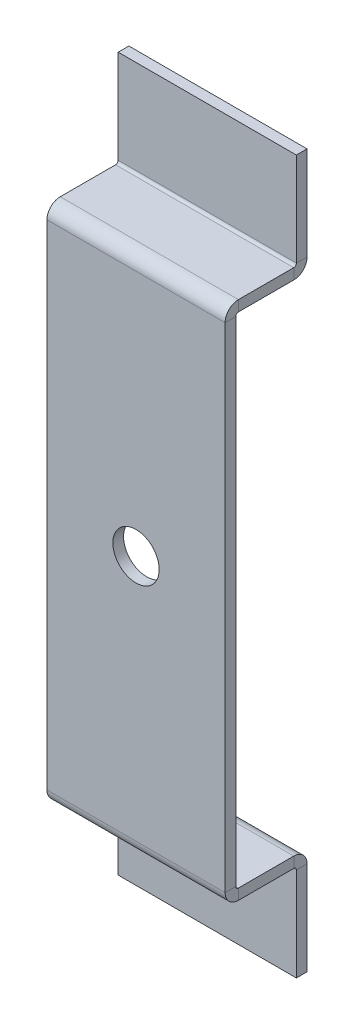
from build123d import *

# Parameters (mm, degrees)
SKETCH_1_W                         = 50
SKETCH_1_H                         = 140
SM_BASE_FLANGE_1_DEPTH             = 3
SM_EDGE_FLANGE_1_STRIP_W           = 13.4732
SM_EDGE_FLANGE_1_STRIP_H           = 3
SM_EDGE_FLANGE_1_STRIP_CUT_DEPTH   = 50
SM_EDGE_FLANGE_1_STRIP_2_W         = 13.4732
SM_EDGE_FLANGE_1_STRIP_2_H         = 3
SM_EDGE_FLANGE_1_STRIP_CUT_2_DEPTH = 50
SM_EDGE_FLANGE_1_DEPTH             = 50
SM_EDGE_FLANGE_1_BEND_DEPTH        = 50
SM_EDGE_FLANGE_2_STRIP_W           = 13.4732
SM_EDGE_FLANGE_2_STRIP_H           = 3
SM_EDGE_FLANGE_2_STRIP_CUT_DEPTH   = 50
SM_EDGE_FLANGE_2_STRIP_2_W         = 13.4732
SM_EDGE_FLANGE_2_STRIP_2_H         = 3
SM_EDGE_FLANGE_2_STRIP_CUT_2_DEPTH = 50
SM_EDGE_FLANGE_2_DEPTH             = 50
SM_EDGE_FLANGE_2_BEND_DEPTH        = 50
SKETCH_18_R                        = 6.5
CUT_EXTRUDE_1_DEPTH                = 179.686876966


# Sheet-metal steps are written as plain solids
with BuildPart() as part:
    # Sketch 1 → 基体-法兰1 (new body)
    with BuildSketch(Plane.XY):
        with Locations((25, 70)):
            Rectangle(SKETCH_1_W, SKETCH_1_H)
    extrude(amount=-SM_BASE_FLANGE_1_DEPTH)

    # 边线-法兰1 strip (across the edge) → 边线-法兰1 strip cut (cut)
    with BuildSketch(Plane(origin=(0, 140, -3), x_dir=(0, -1, 0), z_dir=(1, 0, 0))):
        with Locations((-6, -1.5)):
            Rectangle(SM_EDGE_FLANGE_1_STRIP_W, SM_EDGE_FLANGE_1_STRIP_H)
    extrude(amount=SM_EDGE_FLANGE_1_STRIP_CUT_DEPTH, mode=Mode.SUBTRACT)

    # 边线-法兰1 strip 2 (across the edge) → 边线-法兰1 strip cut 2 (cut)
    with BuildSketch(Plane(origin=(50, 0, -3), x_dir=(0, 1, 0), z_dir=(-1, 0, 0))):
        with Locations((-6, -1.5)):
            Rectangle(SM_EDGE_FLANGE_1_STRIP_2_W, SM_EDGE_FLANGE_1_STRIP_2_H)
    extrude(amount=SM_EDGE_FLANGE_1_STRIP_CUT_2_DEPTH, mode=Mode.SUBTRACT)

    # 边线-法兰1 section (across the edge) → 边线-法兰1 (add)
    with BuildSketch(Plane(origin=(0, 140, -3), x_dir=(0, -1, 0), z_dir=(1, 0, 0))):
        with BuildLine():
            Line((-3, 0.7366), (-3, 17))
            Line((-3, 17), (0, 17))
            Line((0, 17), (0, 0.7366))
            ThreePointArc((0, 0.7366), (0.215745145, 0.215745145), (0.7366, 0))
            Line((0.7366, 0), (0.7366, -3))
            ThreePointArc((0.7366, -3), (-1.905575199, -1.905575199), (-3, 0.7366))
        make_face()
    extrude(amount=SM_EDGE_FLANGE_1_DEPTH)

    # 边线-法兰1 section 2 (across the edge) → 边线-法兰1 bend (add)
    with BuildSketch(Plane(origin=(50, 0, -3), x_dir=(0, 1, 0), z_dir=(-1, 0, 0))):
        with BuildLine():
            Line((-3, 0.7366), (-3, 17))
            Line((-3, 17), (0, 17))
            Line((0, 17), (0, 0.7366))
            ThreePointArc((0, 0.7366), (0.215745145, 0.215745145), (0.7366, 0))
            Line((0.7366, 0), (0.7366, -3))
            ThreePointArc((0.7366, -3), (-1.905575199, -1.905575199), (-3, 0.7366))
        make_face()
    extrude(amount=SM_EDGE_FLANGE_1_BEND_DEPTH)

    # 边线-法兰2 strip (across the edge) → 边线-法兰2 strip cut (cut)
    with BuildSketch(Plane(origin=(0, -3, -20), x_dir=(0, 0, 1), z_dir=(1, 0, 0))):
        with Locations((-6, -1.5)):
            Rectangle(SM_EDGE_FLANGE_2_STRIP_W, SM_EDGE_FLANGE_2_STRIP_H)
    extrude(amount=SM_EDGE_FLANGE_2_STRIP_CUT_DEPTH, mode=Mode.SUBTRACT)

    # 边线-法兰2 strip 2 (across the edge) → 边线-法兰2 strip cut 2 (cut)
    with BuildSketch(Plane(origin=(50, 143, -20), x_dir=(0, 0, 1), z_dir=(-1, 0, 0))):
        with Locations((-6, -1.5)):
            Rectangle(SM_EDGE_FLANGE_2_STRIP_2_W, SM_EDGE_FLANGE_2_STRIP_2_H)
    extrude(amount=SM_EDGE_FLANGE_2_STRIP_CUT_2_DEPTH, mode=Mode.SUBTRACT)

    # 边线-法兰2 section (across the edge) → 边线-法兰2 (add)
    with BuildSketch(Plane(origin=(0, -3, -20), x_dir=(0, 0, 1), z_dir=(1, 0, 0))):
        with BuildLine():
            Line((-3, 0.7366), (-3, 27))
            Line((-3, 27), (0, 27))
            Line((0, 27), (0, 0.7366))
            ThreePointArc((0, 0.7366), (0.215745145, 0.215745145), (0.7366, 0))
            Line((0.7366, 0), (0.7366, -3))
            ThreePointArc((0.7366, -3), (-1.905575199, -1.905575199), (-3, 0.7366))
        make_face()
    extrude(amount=SM_EDGE_FLANGE_2_DEPTH)

    # 边线-法兰2 section 2 (across the edge) → 边线-法兰2 bend (add)
    with BuildSketch(Plane(origin=(50, 143, -20), x_dir=(0, 0, 1), z_dir=(-1, 0, 0))):
        with BuildLine():
            Line((-3, 0.7366), (-3, 27))
            Line((-3, 27), (0, 27))
            Line((0, 27), (0, 0.7366))
            ThreePointArc((0, 0.7366), (0.215745145, 0.215745145), (0.7366, 0))
            Line((0.7366, 0), (0.7366, -3))
            ThreePointArc((0.7366, -3), (-1.905575199, -1.905575199), (-3, 0.7366))
        make_face()
    extrude(amount=SM_EDGE_FLANGE_2_BEND_DEPTH)

    # 草图18 → 切除-拉伸1 (cut, through all)
    with BuildSketch(Plane.XY):
        with Locations((25, 70)):
            Circle(SKETCH_18_R)
    extrude(amount=-CUT_EXTRUDE_1_DEPTH, mode=Mode.SUBTRACT)


solid = part.part
